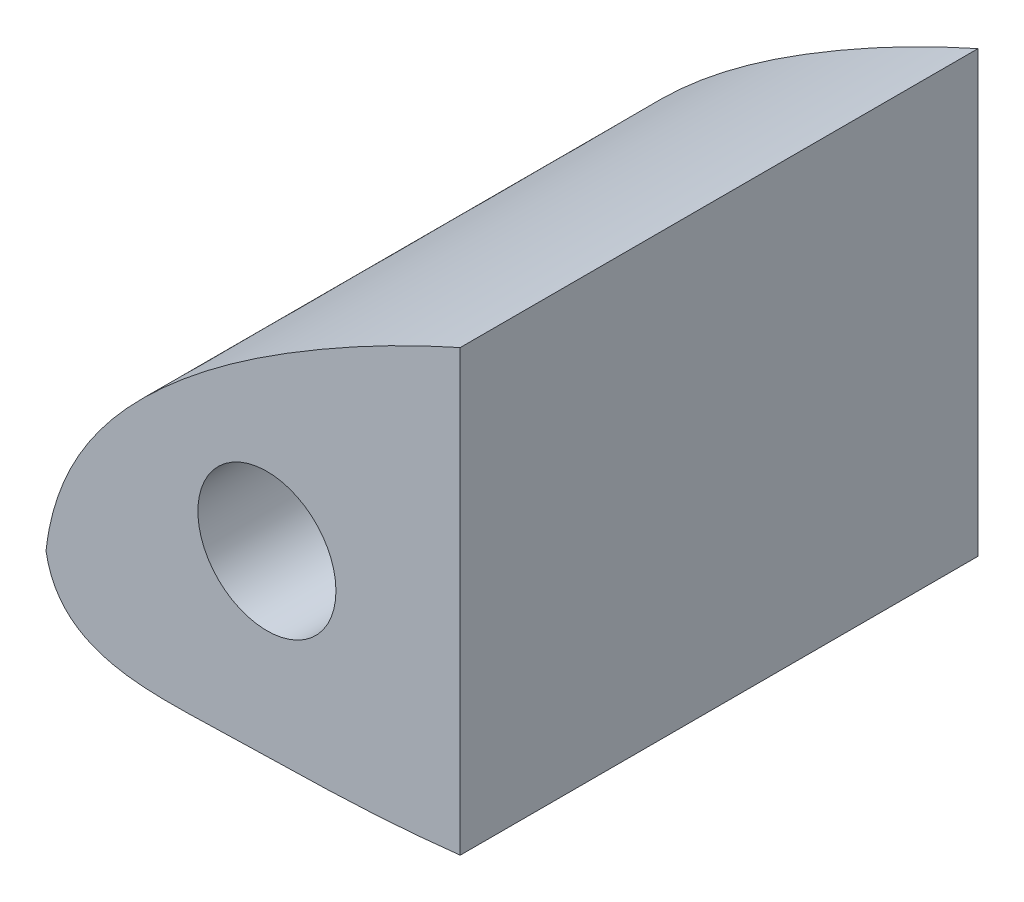
from build123d import *

# Parameters (mm, degrees)
BOSS_EXTRUDE1_DEPTH = 47.625
SKETCH2_R           = 6.35
SKETCH2_R_2         = 3.175
CUT_EXTRUDE1_DEPTH  = 320.299711675
SKETCH3_W           = 293.188888759
SKETCH3_H           = 137.971241769
CUT_EXTRUDE2_DEPTH  = 320.299711675


with BuildPart() as part:
    # Sketch1 → Boss-Extrude1 (new body)
    with BuildSketch(Plane.XY):
        with BuildLine():
            add(Edge.make_bspline(
                [(0.000560351, 0.000130087), (0.810633127, 7.359196055), (8.649092025, 17.856605174), (26.286719818, 29.975176328), (52.111128271, 42.069215275), (89.597618475, 49.290763054), (131.400792109, 47.884831915), (173.256699242, 40.041104278), (217.961060472, 29.612974894), (256.952064401, 19.528920948), (290.35983767, 8.71099439), (301.273197721, 4.382828139), (314.816918223, -0.516206742), (309.846313895, 0.000130087)],
                knots=[0, 0, 0, 0, 0.060863618, 0.113688265, 0.188608742, 0.312908923, 0.448482434, 0.557612135, 0.691544113, 0.852438279, 0.92975597, 0.976058229, 1, 1, 1, 1], degree=3))
            add(Edge.make_bspline(
                [(309.846313895, 0.000130087), (303.956832565, 1.47095521), (293.989507544, 2.093987313), (276.26402299, 4.514356704), (260.846344817, 5.427413394), (235.858814759, 7.870306192), (205.101424636, 8.838080282), (157.718638092, 9.030650149), (110.497331172, 6.181495223), (66.506197185, -0.586669107), (36.454672816, -6.098499901), (15.316603331, -6.189065841), (1.230714189, -6.924076091), (0.000560351, 0.000130087)],
                knots=[0, 0, 0, 0, 0.057787081, 0.095274891, 0.171021118, 0.205339302, 0.335319146, 0.464904334, 0.658702312, 0.785511947, 0.893517288, 0.94309214, 1, 1, 1, 1], degree=3))
        make_face()
    extrude(amount=BOSS_EXTRUDE1_DEPTH)

    # Sketch2 → Cut-Extrude1 (cut, through all)
    with BuildSketch(Plane.XY.offset(47.625)):
        with Locations((20.32, 10.16)):
            Circle(SKETCH2_R)
        with Locations((227.296313895, 19.050130087)):
            Circle(SKETCH2_R_2)
    extrude(amount=-CUT_EXTRUDE1_DEPTH, mode=Mode.SUBTRACT)

    # Sketch3 → Cut-Extrude2 (cut, through all)
    with BuildSketch(Plane.XY.offset(47.625)):
        with Locations((184.69444438, 2.732377951)):
            Rectangle(SKETCH3_W, SKETCH3_H)
    extrude(amount=-CUT_EXTRUDE2_DEPTH, mode=Mode.SUBTRACT)


solid = part.part
